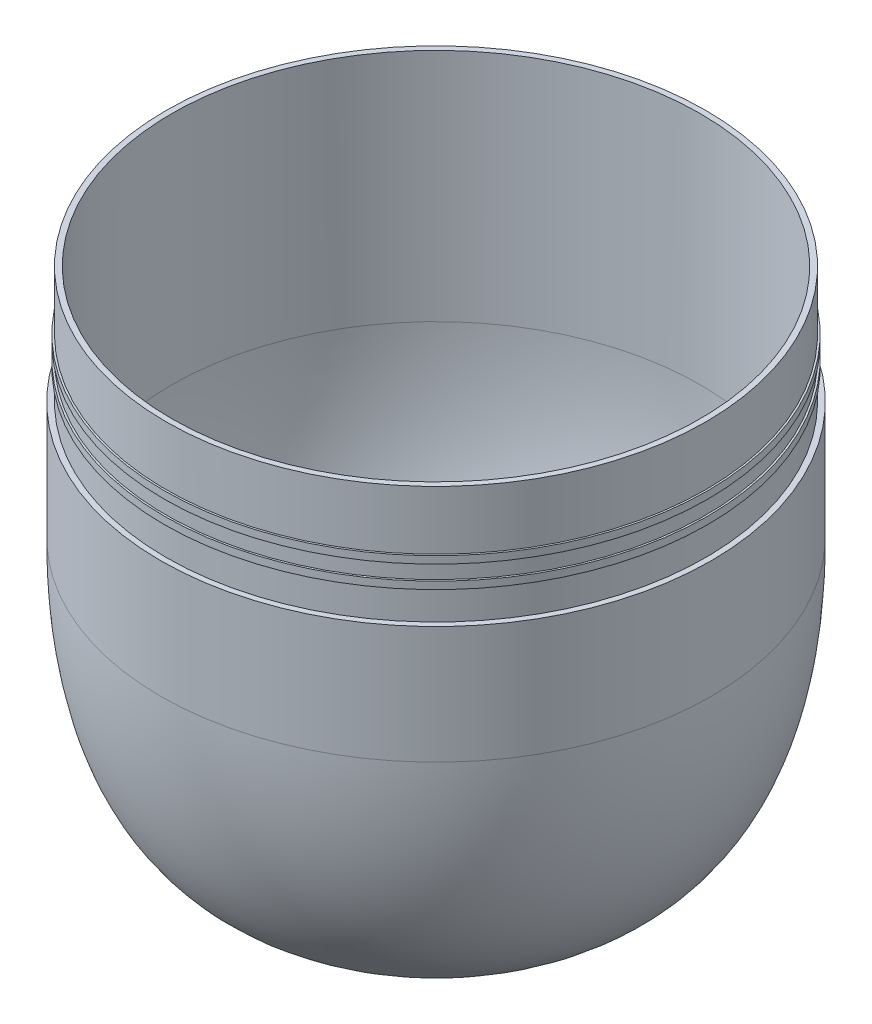
from build123d import *

# Parameters (mm, degrees)
THICKEN1_T1               = 1.5
SKETCH2_R                 = 36.75
SKETCH2_R_2               = 36
BOSS_EXTRUDE2_DEPTH       = 16
BOSS_EXTRUDE3_START       = -177.254011915
BOSS_EXTRUDE3_OUTLINE_R   = 37
BOSS_EXTRUDE3_DEPTH       = 1
BOSS_EXTRUDE3_START_2     = -174.254011915
BOSS_EXTRUDE3_2_OUTLINE_R = 37
BOSS_EXTRUDE3_2_DEPTH     = 1
SKETCH4_R                 = 36
CUT_EXTRUDE1_DEPTH        = 5
SKETCH5_R                 = 2.5
CUT_EXTRUDE2_DEPTH        = 0.5
CHAMFER1_SIZE             = 0.5
SKETCH7_W                 = 0.25
SKETCH7_H                 = 2
BOSS_EXTRUDE4_DEPTH       = 0.1
SKETCH8_R                 = 0.47250604
BOSS_EXTRUDE5_DEPTH       = 0.1
CHAMFER2_SIZE             = 0.05
SKETCH9_R                 = 9.5
BOSS_EXTRUDE6_DEPTH       = 0.5
SKETCH10_R                = 3.5
BOSS_EXTRUDE7_DEPTH       = 0.5
CHAMFER3_SIZE             = 0.22
CHAMFER3_SIZE2            = 2.514611507


# Read off the part's stored shape, not the designer's step: Boss-Extrude3
with BuildPart() as body_1:
    # Surface-Revolve1: a surface, the sketch's curves turned about an axis
    with BuildLine(Plane.XY, mode=Mode.PRIVATE) as surface_revolve1_1_path:
        Line((-37.5, -181.254011915), (-37.5, -197.254011915))
        add(Edge.make_bspline(
            [(-37.5, -197.254011915), (-37.5, -222.631985378), (-27.662087221, -235.254011915), (-12.5, -235.254011915)],
            knots=[0, 0, 0, 0, 1, 1, 1, 1], degree=3))
        Line((-12.5, -235.254011915), (0, -235.254011915))
    surface_revolve1_1 = Shell.revolve(surface_revolve1_1_path.wire(), 360, Axis((0, -878.903951825, 0), (0, 1, 0)))
    add(Solid.thicken(surface_revolve1_1, THICKEN1_T1))

    # Sketch2 → Boss-Extrude2 (add)
    with BuildSketch(Plane(origin=(0, -181.254011915, 0), x_dir=(1, 0, 0), z_dir=(0, 1, 0))):
        with Locations(Location((0, 0, 0), (0, 0, 270))):
            Circle(SKETCH2_R)
        with Locations(Location((0, 0, 0), (0, 0, 270))):
            Circle(SKETCH2_R_2, mode=Mode.SUBTRACT)
    extrude(amount=BOSS_EXTRUDE2_DEPTH)

    # Boss-Extrude3 outline → Boss-Extrude3 (add)
    with BuildSketch(Plane(origin=(0, 0, 0), x_dir=(1, 0, 0), z_dir=(0, 1, 0)).offset(BOSS_EXTRUDE3_START)):
        Circle(BOSS_EXTRUDE3_OUTLINE_R)
    extrude(amount=BOSS_EXTRUDE3_DEPTH)

    # Boss-Extrude3 2 outline → Boss-Extrude3 2 (add)
    with BuildSketch(Plane(origin=(0, 0, 0), x_dir=(1, 0, 0), z_dir=(0, 1, 0)).offset(BOSS_EXTRUDE3_START_2)):
        Circle(BOSS_EXTRUDE3_2_OUTLINE_R)
    extrude(amount=BOSS_EXTRUDE3_2_DEPTH)

    # Sketch4 → Cut-Extrude1 (cut)
    with BuildSketch(Plane(origin=(0, -173.254011915, 0), x_dir=(1, 0, 0), z_dir=(0, 1, 0))):
        with Locations(Location((0, 0, 0), (0, 0, 270))):
            Circle(SKETCH4_R)
    extrude(amount=-CUT_EXTRUDE1_DEPTH, mode=Mode.SUBTRACT)

    # Sketch5 → Cut-Extrude2 (cut)
    with BuildSketch(Plane.XZ.offset(235.254011915)):
        with Locations(Location((0, 0, 0), (0, 0, 270))):
            Circle(SKETCH5_R)
    extrude(amount=-CUT_EXTRUDE2_DEPTH, mode=Mode.SUBTRACT)

    # Chamfer1
    chamfer1_edges = [body_1.edges().sort_by_distance(p)[0] for p in [
        (0, -235.254011915, 2.5),
    ]]
    chamfer(chamfer1_edges, length=CHAMFER1_SIZE - 0.0001)  # a hair under: the kernel refuses the full size

    # Sketch7 → Boss-Extrude4 (add)
    with BuildSketch(Plane.XZ.offset(235.254011915)):
        Polygon((-3.75, 6.855827076), (-3.080858935, 5.855827076), (-3.080858935, 3.855827076), (-2.830858935, 3.855827076), (-2.830858935, 5.855827076), (-3.5, 6.855827076), (-3.5, 8.855827076), (-3.75, 8.855827076), align=None)
        with BuildLine():
            Line((0, 8.855827076), (3, 8.855827076))
            Line((3, 8.855827076), (3, 8.605827076))
            add(Edge.make_bspline(
                [(3, 8.605827076), (2.842694866, 7.155889233), (2.2, 5.855827076)],
                knots=[0, 0, 0, 1, 1, 1], degree=2))
            Line((2.2, 5.855827076), (3, 3.855827076))
            Line((3, 3.855827076), (2.75, 3.855827076))
            Line((2.75, 3.855827076), (1.95, 5.855827076))
            add(Edge.make_bspline(
                [(2.75, 8.605827076), (2.639405936, 7.140642131), (1.95, 5.855827076)],
                knots=[0, 0, 0, 1, 1, 1], degree=2))
            Line((2.75, 8.605827076), (0.25, 8.605827076))
            add(Edge.make_bspline(
                [(0.25, 8.605827076), (0.360594064, 7.140642131), (1.05, 5.855827076)],
                knots=[0, 0, 0, 1, 1, 1], degree=2))
            Line((1.05, 5.855827076), (0.25, 3.855827076))
            Line((0.25, 3.855827076), (0, 3.855827076))
            Line((0, 3.855827076), (0.8, 5.855827076))
            add(Edge.make_bspline(
                [(0, 8.605827076), (0.157305134, 7.155889233), (0.8, 5.855827076)],
                knots=[0, 0, 0, 1, 1, 1], degree=2))
            Line((0, 8.605827076), (0, 8.855827076))
        make_face()
        with Locations((-1.125, 7.855827076)):
            Rectangle(SKETCH7_W, SKETCH7_H)
        with Locations((-2.375, 7.855827076)):
            Rectangle(SKETCH7_W, SKETCH7_H)
    extrude(amount=BOSS_EXTRUDE4_DEPTH)

    # Sketch9 → Boss-Extrude6 (add)
    with BuildSketch(Plane(origin=(0, -233.754011915, 0), x_dir=(-1, 0, 0), z_dir=(0, 1, 0))):
        with Locations(Location((0, 0, 0), (0, 0, 90))):
            Circle(SKETCH9_R)
    extrude(amount=BOSS_EXTRUDE6_DEPTH)

    # Sketch10 → Boss-Extrude7 (add)
    with BuildSketch(Plane(origin=(0, -233.254011915, 0), x_dir=(1, 0, 0), z_dir=(0, 1, 0))):
        with Locations(Location((0, 0, 0), (0, 0, 270))):
            Circle(SKETCH10_R)
    extrude(amount=BOSS_EXTRUDE7_DEPTH)

    # Chamfer3
    chamfer3_edges = [body_1.edges().sort_by_distance(p)[0] for p in [
        (0, -232.754011915, -3.5),
    ]]
    chamfer3_side = [body_1.faces().sort_by_distance(p)[0] for p in [
        (0, -233.004011915, -3.5),
    ]]
    chamfer(chamfer3_edges, length=CHAMFER3_SIZE, length2=CHAMFER3_SIZE2, reference=chamfer3_side[0])


with BuildPart() as body_2:
    # Sketch8 → Boss-Extrude5 (new body)
    with BuildSketch(Plane.XZ.offset(235.254011915)):
        with Locations(Location((0, 0, 0), (0, 0, 270))):
            Circle(SKETCH8_R)
    extrude(amount=BOSS_EXTRUDE5_DEPTH)

    # Chamfer2
    chamfer2_edges = [body_2.edges().sort_by_distance(p)[0] for p in [
        (0, -235.354011915, 0.47250604),
    ]]
    chamfer(chamfer2_edges, length=CHAMFER2_SIZE)


solid = Compound([body_1.part, body_2.part])
